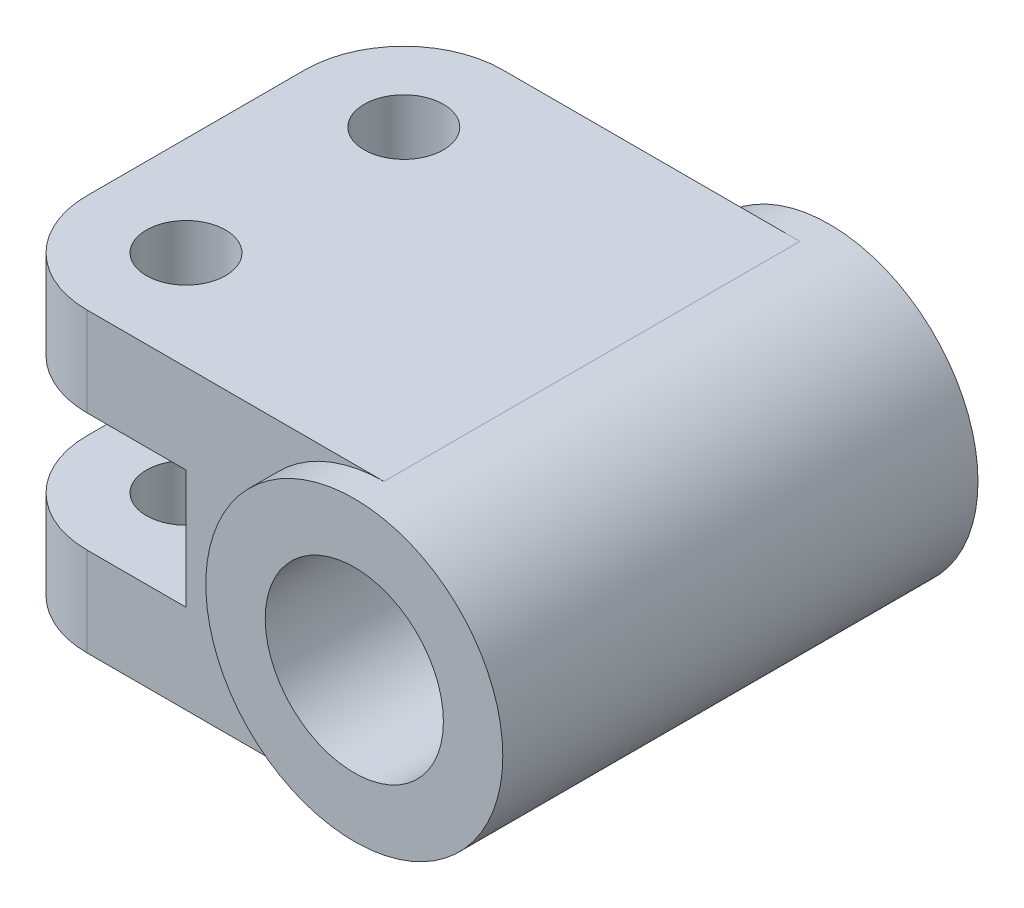
from build123d import *
from build123d.topology import SkipClean

# Parameters (mm, degrees)
SKETCH_1_R               = 9
EXTRUDE_1_DEPTH          = 42
EXTRUDE_3_DEPTH          = 3
EXTRUDE_3_DEPTH_BACK     = 45
SKETCH_2_R               = 15
SKETCH_2_R_2             = 9
CUT_EXTRUDE_1_DEPTH      = 78.136243103
CUT_EXTRUDE_1_DEPTH_BACK = 78.136243103
SKETCH_3_R               = 4
CUT_EXTRUDE_2_DEPTH      = 78.136243103
CUT_EXTRUDE_2_DEPTH_BACK = 78.136243103
SKETCH_4_R               = 4
FILLET_5_R               = 10


with BuildPart() as part:
    # 草图1 → 凸台-拉伸1 (new body)
    with BuildSketch(Plane.XY):
        with BuildLine():
            Line((0, 9), (0, 0))
            Line((0, 0), (40, 0))
            ThreePointArc((40, 0), (55, 15), (40, 30))
            Line((40, 30), (0, 30))
            Line((0, 30), (0, 21))
            Line((0, 21), (20, 21))
            Line((20, 21), (20, 9))
            Line((20, 9), (0, 9))
        make_face()
        with Locations((40, 15)):
            Circle(SKETCH_1_R, mode=Mode.SUBTRACT)
    extrude(amount=EXTRUDE_1_DEPTH)

    # 草图2 → 凸台-拉伸3 (add, two sides: drawn at the far end of the back side and taken through both)
    with SkipClean():  # the faces are left unmerged after this step: merging them gives an invalid solid
        with BuildSketch(Plane.XY.offset(42).offset(-EXTRUDE_3_DEPTH_BACK)):
            with Locations((40, 15)):
                Circle(SKETCH_2_R)
            with Locations((40, 15)):
                Circle(SKETCH_2_R_2, mode=Mode.SUBTRACT)
        extrude(amount=EXTRUDE_3_DEPTH + EXTRUDE_3_DEPTH_BACK)
    add(part.part.scale(1), mode=Mode.REPLACE)  # the faces are merged on a copy

    # 草图3 → 切除-拉伸1 (cut, two sides: drawn at the far end of the back side and taken through both)
    with BuildSketch(Plane(origin=(0, 30, 0), x_dir=(1, 0, 0), z_dir=(0, 1, 0)).offset(-CUT_EXTRUDE_1_DEPTH_BACK)):
        with Locations((10, -10)):
            Circle(SKETCH_3_R)
    extrude(amount=CUT_EXTRUDE_1_DEPTH + CUT_EXTRUDE_1_DEPTH_BACK, mode=Mode.SUBTRACT)

    # 草图4 → 切除-拉伸2 (cut, two sides: drawn at the far end of the back side and taken through both)
    with BuildSketch(Plane(origin=(0, 30, 0), x_dir=(1, 0, 0), z_dir=(0, 1, 0)).offset(-CUT_EXTRUDE_2_DEPTH_BACK)):
        with Locations((10, -32)):
            Circle(SKETCH_4_R)
    extrude(amount=CUT_EXTRUDE_2_DEPTH + CUT_EXTRUDE_2_DEPTH_BACK, mode=Mode.SUBTRACT)

    # 圆角5
    fillet_5_edges = [part.edges().sort_by_distance(p)[0] for p in [
        (0, 25.5, 0),
        (0, 4.5, 0),
        (0, 4.5, 42),
        (0, 25.5, 42),
    ]]
    fillet(fillet_5_edges, radius=FILLET_5_R)


solid = part.part
